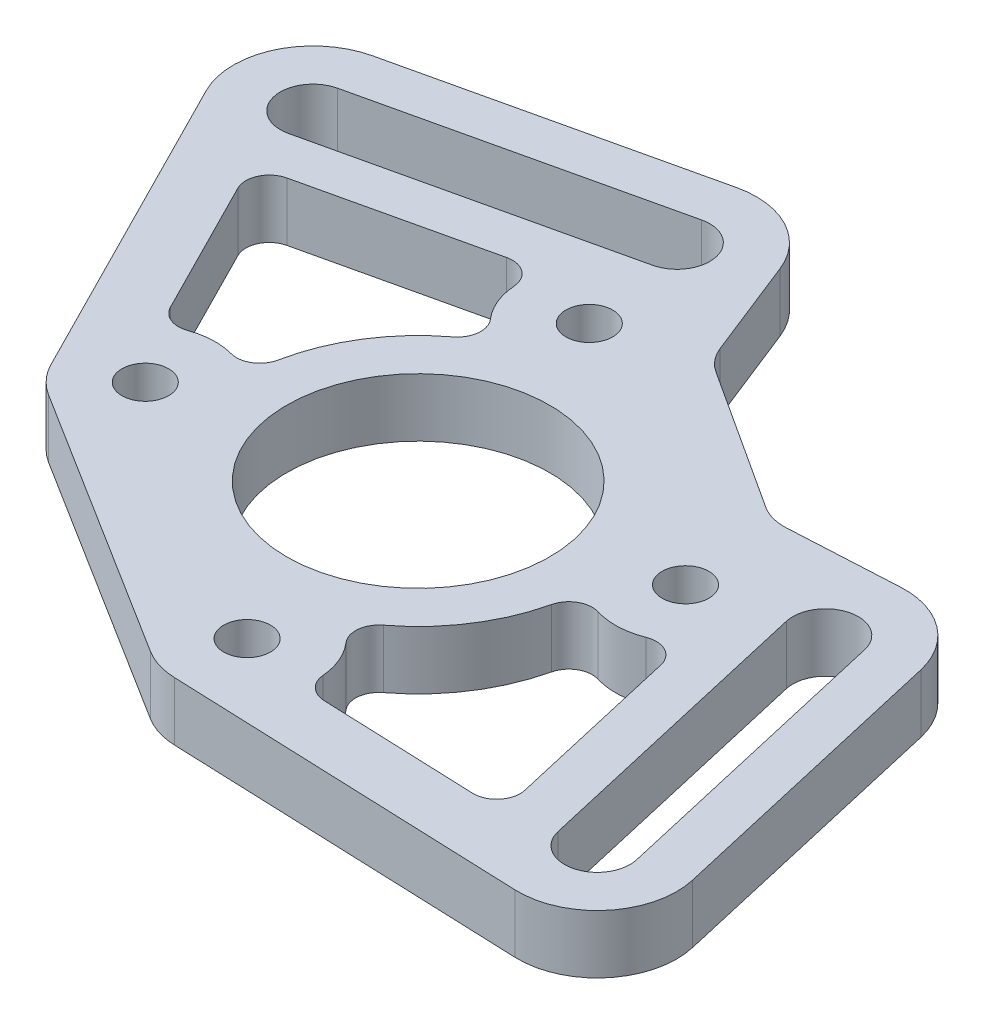
from build123d import *

# Parameters (mm, degrees)
SKETCH1_R           = 2.54
SKETCH1_R_2         = 14.2875
BOSS_EXTRUDE1_DEPTH = 6.35
CUT_EXTRUDE1_DEPTH  = 70.66923735
FILLET1_R           = 2.54


with BuildPart() as part:
    # Sketch1 → Boss-Extrude1 (new body)
    with BuildSketch(Plane(origin=(0, 0, 0), x_dir=(1, 0, 0), z_dir=(0, 1, 0))):
        with BuildLine():
            Line((-10.301536111, 44.922263418), (-42.486128255, 37.541719497))
            ThreePointArc((-42.486128255, 37.541719497), (-48.376257791, 32.787738977), (-48.258608454, 25.219376184))
            Line((-48.258608454, 25.219376184), (-30.922632743, -8.978011563))
            ThreePointArc((-30.922632743, -8.978011563), (-29.753188396, -10.670651305), (-28.173552503, -11.988748349))
            Line((-28.173552503, -11.988748349), (1.485082186, -30.582244497))
            ThreePointArc((1.485082186, -30.582244497), (3.286793362, -31.407609936), (5.240405543, -31.740462332))
            Line((5.240405543, -31.740462332), (43.718670442, -33.216869907))
            ThreePointArc((43.718670442, -33.216869907), (50.700017874, -30.096753296), (52.467298047, -22.656923969))
            Line((52.467298047, -22.656923969), (45.086754126, 9.527668174))
            ThreePointArc((45.086754126, 9.527668174), (41.870070274, 14.491711544), (36.213465331, 16.221336388))
            Line((36.213465331, 16.221336388), (24.402688291, 15.597131936))
            ThreePointArc((24.402688291, 15.597131936), (22.820864626, 15.76285886), (21.367816063, 16.409605637))
            Line((21.367816063, 16.409605637), (5.906875614, 26.450057762))
            ThreePointArc((5.906875614, 26.450057762), (4.742385284, 27.493110687), (3.950204921, 28.84086712))
            Line((3.950204921, 28.84086712), (-0.341397124, 39.683137821))
            ThreePointArc((-0.341397124, 39.683137821), (-4.350888408, 44.147873767), (-10.301536111, 44.922263418))
        make_face()
        with Locations((-5.53256927, 24.126065418)):
            Circle(SKETCH1_R, mode=Mode.SUBTRACT)
        with Locations((24.290556126, 4.758701333)):
            Circle(SKETCH1_R, mode=Mode.SUBTRACT)
        with Locations((5.53256927, -24.126065418)):
            Circle(SKETCH1_R, mode=Mode.SUBTRACT)
        with Locations((-24.126065418, -5.53256927)):
            Circle(SKETCH1_R, mode=Mode.SUBTRACT)
        Circle(SKETCH1_R_2, mode=Mode.SUBTRACT)
        with BuildLine():
            Line((40.135278412, 8.392199879), (47.515822333, -23.792392264))
            ThreePointArc((47.515822333, -23.792392264), (44.84461714, -28.053253071), (40.583756333, -25.382047878))
            Line((40.583756333, -25.382047878), (33.203212412, 6.802544265))
            ThreePointArc((33.203212412, 6.802544265), (35.874417605, 11.063405072), (40.135278412, 8.392199879))
        make_face(mode=Mode.SUBTRACT)
        with BuildLine():
            Line((-7.576412202, 33.038721704), (-39.761004345, 25.658177783))
            ThreePointArc((-39.761004345, 25.658177783), (-44.021865152, 28.329382976), (-41.350659959, 32.590243783))
            Line((-41.350659959, 32.590243783), (-9.166067816, 39.970787704))
            ThreePointArc((-9.166067816, 39.970787704), (-4.905207009, 37.299582511), (-7.576412202, 33.038721704))
        make_face(mode=Mode.SUBTRACT)
    extrude(amount=BOSS_EXTRUDE1_DEPTH)

    # Sketch3 → Cut-Extrude1 (cut, through all)
    with BuildSketch(Plane(origin=(0, 6.35, 0), x_dir=(1, 0, 0), z_dir=(0, 1, 0))):
        with BuildLine():
            Line((29.692484449, -0.615642385), (35.632280619, -26.517516174))
            ThreePointArc((35.632280619, -26.517516174), (35.636280873, -26.534877998), (35.640316938, -26.552231532))
            Line((35.640316938, -26.552231532), (12.991771922, -25.68320889))
            ThreePointArc((12.991771922, -25.68320889), (12.360044144, -20.742282498), (8.810828705, -17.247299898))
            ThreePointArc((8.810828705, -17.247299898), (16.242952225, -10.548296511), (19.339879369, -1.033983679))
            ThreePointArc((19.339879369, -1.033983679), (24.598223728, -2.85508489), (29.692484449, -0.615642385))
        make_face()
        with BuildLine():
            Line((-38.62553605, 20.706702069), (-12.723662261, 26.646498238))
            ThreePointArc((-12.723662261, 26.646498238), (-12.567344847, 21.197527799), (-8.810828705, 17.247299898))
            ThreePointArc((-8.810828705, 17.247299898), (-16.40945516, 10.287363006), (-19.363045216, 0.415374791))
            ThreePointArc((-19.363045216, 0.415374791), (-23.979054852, 2.086012481), (-28.656078555, 0.594696105))
            Line((-28.656078555, 0.594696105), (-38.829256345, 20.662566027))
            ThreePointArc((-38.829256345, 20.662566027), (-38.727263029, 20.684019377), (-38.62553605, 20.706702069))
        make_face()
    extrude(amount=-CUT_EXTRUDE1_DEPTH, mode=Mode.SUBTRACT)

    # Fillet1
    fillet1_edges = [part.edges().sort_by_distance(p)[0] for p in [
        (35.640316938, 3.175, 26.552231532),
        (8.810828705, 3.175, 17.247299898),
        (12.991771922, 3.175, 25.68320889),
        (29.692484449, 3.175, 0.615642385),
        (19.339879369, 3.175, 1.033983679),
        (-38.829256345, 3.175, -20.662566027),
        (-28.656078555, 3.175, -0.594696105),
        (-19.363045216, 3.175, -0.415374791),
        (-8.810828705, 3.175, -17.247299898),
        (-12.723662261, 3.175, -26.646498238),
    ]]
    fillet(fillet1_edges, radius=FILLET1_R)


solid = part.part
